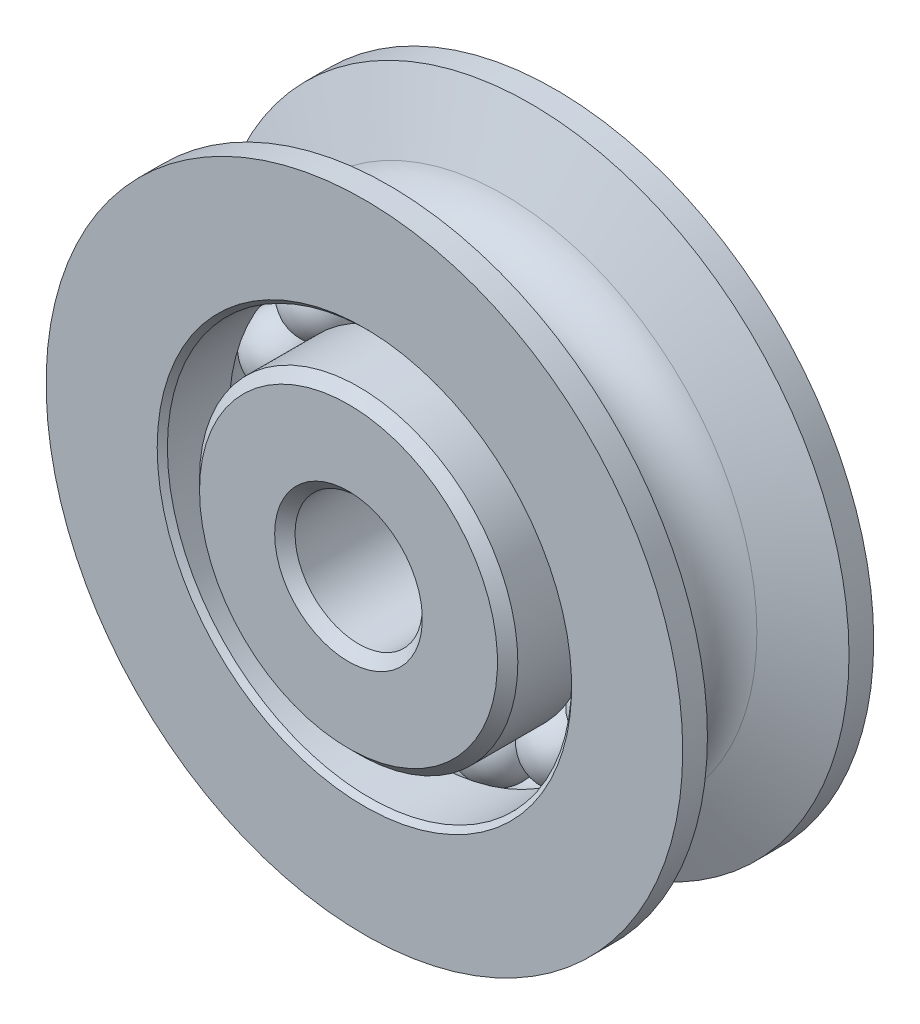
from build123d import *

# Parameters (mm, degrees)
CIRPATTERN1_COUNT = 15
CHAMFER1_SIZE     = 0.508
CHAMFER2_SIZE     = 0.254


with BuildPart() as part:
    # Sketch1 → Revolve1 (revolve)
    with BuildSketch(Plane(origin=(0, 0, 0), x_dir=(0, 0, -1), z_dir=(1, 0, 0))):
        with BuildLine():
            Line((3.5306, 15.875), (4.7625, 15.875))
            Line((4.7625, 15.875), (4.7625, 10.080625))
            Line((4.7625, 10.080625), (1.42875, 10.080625))
            ThreePointArc((1.42875, 10.080625), (0, 10.795), (-1.42875, 10.080625))
            Line((-1.42875, 10.080625), (-4.7625, 10.080625))
            Line((-4.7625, 10.080625), (-4.7625, 15.875))
            Line((-4.7625, 15.875), (-3.5306, 15.875))
            Line((-3.5306, 15.875), (-2.207797586, 12.601572113))
            ThreePointArc((-2.207797586, 12.601572113), (0, 11.1125), (2.207797586, 12.601572113))
            Line((2.207797586, 12.601572113), (3.5306, 15.875))
        make_face()
        with BuildLine():
            Line((5.55625, 3.175), (-5.55625, 3.175))
            Line((-5.55625, 3.175), (-5.55625, 7.9375))
            Line((-5.55625, 7.9375), (-1.42875, 7.9375))
            ThreePointArc((-1.42875, 7.9375), (0, 7.223125), (1.42875, 7.9375))
            Line((1.42875, 7.9375), (5.55625, 7.9375))
            Line((5.55625, 7.9375), (5.55625, 3.175))
        make_face()
    revolve(axis=Axis((0, 0, 5.55625), (0, 0, -1)))

    # Chamfer1
    chamfer1_edges = [part.edges().sort_by_distance(p)[0] for p in [
        (0, -3.175, -5.55625),
        (0, -7.9375, -5.55625),
        (0, -7.9375, 5.55625),
        (0, -3.175, 5.55625),
    ]]
    chamfer(chamfer1_edges, length=CHAMFER1_SIZE)

    # Chamfer2
    chamfer2_edges = [part.edges().sort_by_distance(p)[0] for p in [
        (0, -10.080625, -4.7625),
        (0, -10.080625, 4.7625),
    ]]
    chamfer(chamfer2_edges, length=CHAMFER2_SIZE)


with BuildPart() as body_2:
    # Sketch2 → Revolve2 (revolve)
    with BuildSketch(Plane(origin=(0, 0, 0), x_dir=(0, 0, -1), z_dir=(1, 0, 0))):
        with BuildLine():
            Line((0, 10.795), (0, 7.223125))
            ThreePointArc((0, 7.223125), (1.7859375, 9.0090625), (0, 10.795))
        make_face()
    revolve(axis=Axis((0, 10.795, 0), (0, -1, 0)))


with BuildPart() as cirpattern1_1:
    # CirPattern1: pattern copy
    add(body_2.part.rotate(Axis((0, 0, 0), (0, 0, -1)), 1 * 360 / CIRPATTERN1_COUNT))


with BuildPart() as cirpattern1_2:
    # CirPattern1: pattern copy
    add(body_2.part.rotate(Axis((0, 0, 0), (0, 0, -1)), 2 * 360 / CIRPATTERN1_COUNT))


with BuildPart() as cirpattern1_3:
    # CirPattern1: pattern copy
    add(body_2.part.rotate(Axis((0, 0, 0), (0, 0, -1)), 3 * 360 / CIRPATTERN1_COUNT))


with BuildPart() as cirpattern1_4:
    # CirPattern1: pattern copy
    add(body_2.part.rotate(Axis((0, 0, 0), (0, 0, -1)), 4 * 360 / CIRPATTERN1_COUNT))


with BuildPart() as cirpattern1_5:
    # CirPattern1: pattern copy
    add(body_2.part.rotate(Axis((0, 0, 0), (0, 0, -1)), 5 * 360 / CIRPATTERN1_COUNT))


with BuildPart() as cirpattern1_6:
    # CirPattern1: pattern copy
    add(body_2.part.rotate(Axis((0, 0, 0), (0, 0, -1)), 6 * 360 / CIRPATTERN1_COUNT))


with BuildPart() as cirpattern1_7:
    # CirPattern1: pattern copy
    add(body_2.part.rotate(Axis((0, 0, 0), (0, 0, -1)), 7 * 360 / CIRPATTERN1_COUNT))


with BuildPart() as cirpattern1_8:
    # CirPattern1: pattern copy
    add(body_2.part.rotate(Axis((0, 0, 0), (0, 0, -1)), 8 * 360 / CIRPATTERN1_COUNT))


with BuildPart() as cirpattern1_9:
    # CirPattern1: pattern copy
    add(body_2.part.rotate(Axis((0, 0, 0), (0, 0, -1)), 9 * 360 / CIRPATTERN1_COUNT))


with BuildPart() as cirpattern1_10:
    # CirPattern1: pattern copy
    add(body_2.part.rotate(Axis((0, 0, 0), (0, 0, -1)), 10 * 360 / CIRPATTERN1_COUNT))


with BuildPart() as cirpattern1_11:
    # CirPattern1: pattern copy
    add(body_2.part.rotate(Axis((0, 0, 0), (0, 0, -1)), 11 * 360 / CIRPATTERN1_COUNT))


with BuildPart() as cirpattern1_12:
    # CirPattern1: pattern copy
    add(body_2.part.rotate(Axis((0, 0, 0), (0, 0, -1)), 12 * 360 / CIRPATTERN1_COUNT))


with BuildPart() as cirpattern1_13:
    # CirPattern1: pattern copy
    add(body_2.part.rotate(Axis((0, 0, 0), (0, 0, -1)), 13 * 360 / CIRPATTERN1_COUNT))


with BuildPart() as cirpattern1_14:
    # CirPattern1: pattern copy
    add(body_2.part.rotate(Axis((0, 0, 0), (0, 0, -1)), 14 * 360 / CIRPATTERN1_COUNT))


solid = Compound([part.part, body_2.part, cirpattern1_1.part, cirpattern1_2.part, cirpattern1_3.part, cirpattern1_4.part, cirpattern1_5.part, cirpattern1_6.part, cirpattern1_7.part, cirpattern1_8.part, cirpattern1_9.part, cirpattern1_10.part, cirpattern1_11.part, cirpattern1_12.part, cirpattern1_13.part, cirpattern1_14.part])
